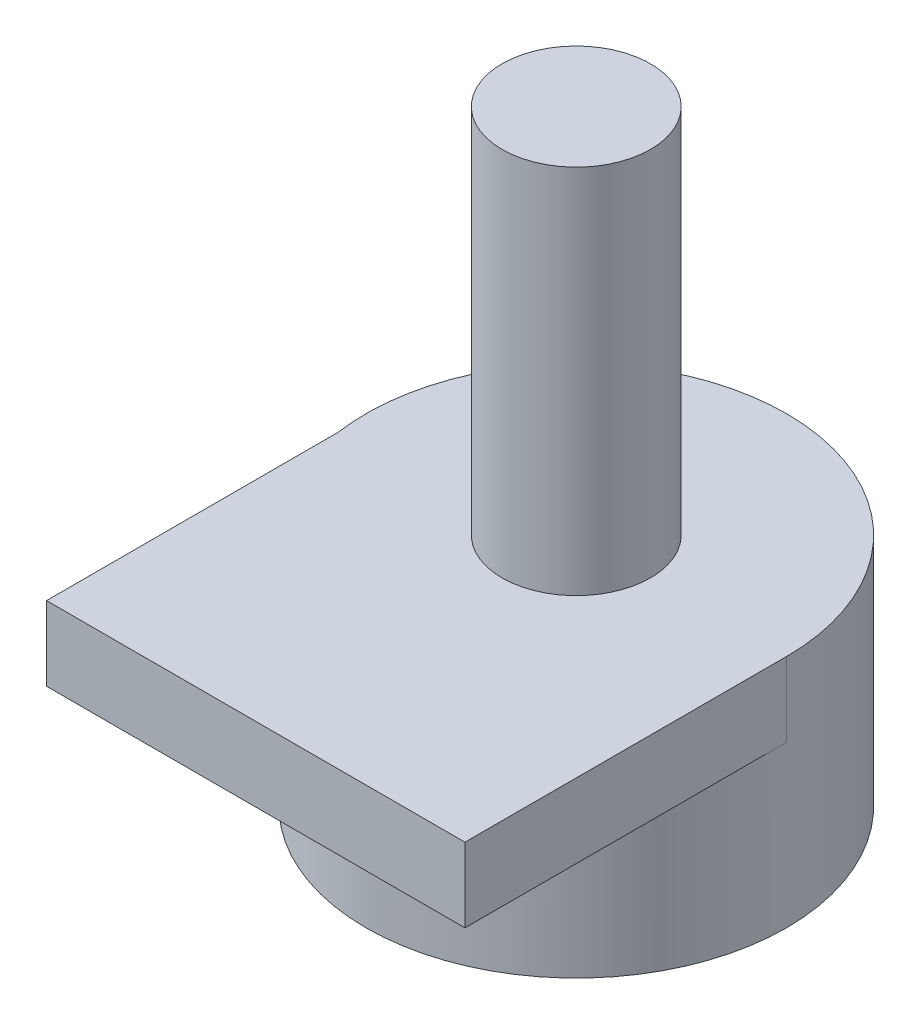
from build123d import *

# Parameters (mm, degrees)
SKETCH1_R           = 8.5
BOSS_EXTRUDE1_DEPTH = 9.5
SKETCH2_R           = 3
BOSS_EXTRUDE2_DEPTH = 15
SKETCH3_W           = 16.912520663
SKETCH3_H           = 13
BOSS_EXTRUDE3_DEPTH = 3


with BuildPart() as part:
    # Sketch1 → Boss-Extrude1 (new body)
    with BuildSketch(Plane(origin=(0, 0, 0), x_dir=(1, 0, 0), z_dir=(0, 1, 0))):
        Circle(SKETCH1_R)
    extrude(amount=BOSS_EXTRUDE1_DEPTH)

    # Sketch2 → Boss-Extrude2 (add)
    with BuildSketch(Plane(origin=(0, 9.5, 0), x_dir=(1, 0, 0), z_dir=(0, 1, 0))):
        Circle(SKETCH2_R)
    extrude(amount=BOSS_EXTRUDE2_DEPTH)

    # Sketch3 → Boss-Extrude3 (add)
    with BuildSketch(Plane(origin=(0, 9.5, 0), x_dir=(1, 0, 0), z_dir=(0, 1, 0))):
        with Locations((0.043739668, -6.5)):
            Rectangle(SKETCH3_W, SKETCH3_H)
    extrude(amount=-BOSS_EXTRUDE3_DEPTH)


solid = part.part
